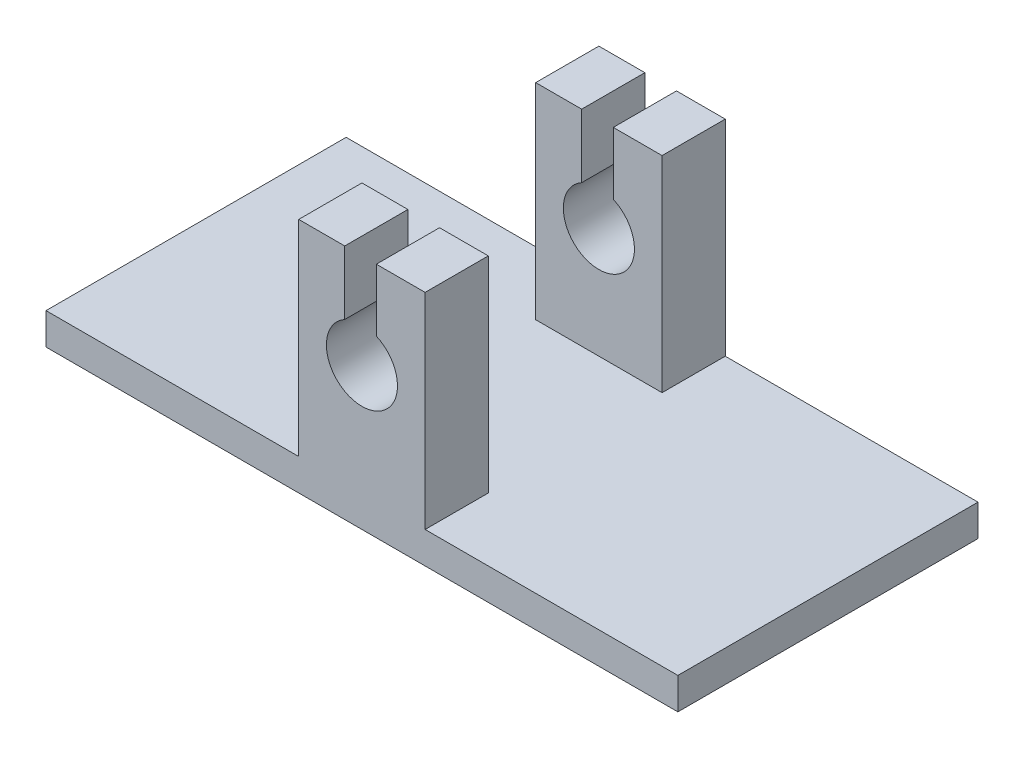
from build123d import *

# Parameters (mm, degrees)
SKETCH2_W           = 254
SKETCH2_H           = 120.65
BOSS_EXTRUDE2_DEPTH = 12.7
SKETCH4_W           = 50.8
SKETCH4_H           = 25.4
BOSS_EXTRUDE3_DEPTH = 82.55
CUT_EXTRUDE1_DEPTH  = 200.394044545


with BuildPart() as part:
    # Sketch2 → Boss-Extrude2 (new body)
    with BuildSketch(Plane(origin=(0, 0, 0), x_dir=(1, 0, 0), z_dir=(0, 1, 0))):
        Rectangle(SKETCH2_W, SKETCH2_H)
    extrude(amount=BOSS_EXTRUDE2_DEPTH)

    # Sketch4 → Boss-Extrude3 (add)
    with BuildSketch(Plane(origin=(0, 12.7, 0), x_dir=(1, 0, 0), z_dir=(0, 1, 0))):
        with Locations((0, -47.625)):
            Rectangle(SKETCH4_W, SKETCH4_H)
    boss_extrude3 = extrude(amount=BOSS_EXTRUDE3_DEPTH)

    # Mirror1: Boss-Extrude3 across plane
    add(boss_extrude3.mirror(Plane.XY))

    # Sketch6 → Cut-Extrude1 (cut, through all)
    with BuildSketch(Plane.XY.offset(60.325)):
        with BuildLine():
            Line((-6.911847883, 95.25), (5.788152117, 95.25))
            Line((5.788152117, 95.25), (5.788152117, 70.212540003))
            ThreePointArc((5.788152117, 70.212540003), (0.627347046, 42.876279674), (-6.911847883, 69.654359843))
            Line((-6.911847883, 69.654359843), (-6.911847883, 95.25))
        make_face()
    extrude(amount=-CUT_EXTRUDE1_DEPTH, mode=Mode.SUBTRACT)


solid = part.part
